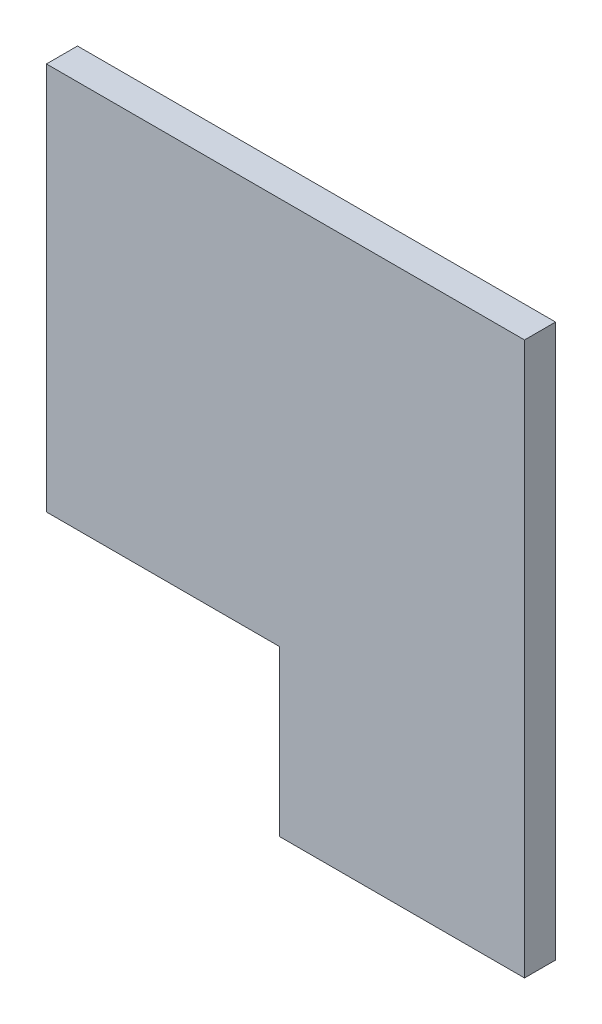
from build123d import *

# Parameters (mm, degrees)
TABAN_FLAN_1_DEPTH         = 50
KES_EKSTR_ZYON1_DEPTH      = 4481.915196698
KES_EKSTR_ZYON1_DEPTH_BACK = 4481.915196698
IZIM2_W                    = 942
IZIM2_H                    = 710
IZIM3_W                    = 11
IZIM3_H                    = 3300
SEKME1_DEPTH               = 50
KES_EKSTR_ZYON2_DEPTH      = 4486.833255929
KES_EKSTR_ZYON2_DEPTH_BACK = 4486.833255929
IZIM4_W                    = 1520
IZIM4_H                    = 310
KES_EKSTR_ZYON3_DEPTH      = 4486.833255929
KES_EKSTR_ZYON3_DEPTH_BACK = 4486.833255929
IZIM6_W                    = 7
IZIM6_H                    = 2435
KES_EKSTR_ZYON4_DEPTH      = 4337.484751501
KES_EKSTR_ZYON4_DEPTH_BACK = 4337.484751501
IZIM7_W                    = 360
IZIM7_H                    = 1550
KES_EKSTR_ZYON5_DEPTH      = 4213.683230436
KES_EKSTR_ZYON5_DEPTH_BACK = 4213.683230436
IZIM8_W                    = 3
IZIM8_H                    = 1550
IZIM8_W_2                  = 58
IZIM8_H_2                  = 885
IZIM9_W                    = 905
IZIM9_H                    = 5
SEKME2_DEPTH               = 50
KES_EKSTR_ZYON6_DEPTH      = 4212.765544282
KES_EKSTR_ZYON6_DEPTH_BACK = 4212.765544282
IZIM10_W                   = 101
IZIM10_H                   = 1555
KES_EKSTR_ZYON7_DEPTH      = 4183.008608313
KES_EKSTR_ZYON7_DEPTH_BACK = 4183.008608313
IZIM11_W                   = 409
IZIM11_H                   = 1555
KES_EKSTR_ZYON8_DEPTH      = 4085.890329005
KES_EKSTR_ZYON8_DEPTH_BACK = 4085.890329005
IZIM13_W                   = 395
IZIM13_H                   = 665


# Sheet-metal steps are written as plain solids
with BuildPart() as part:
    # Çizim1 → Taban-Flanş1 (new body)
    with BuildSketch(Plane.XY):
        Polygon((0, 0), (1427, 0), (1427, 710), (1999, 710), (1999, 4010), (0, 4010), align=None)
    extrude(amount=-TABAN_FLAN_1_DEPTH)

    # Çizim2 → Kes-Ekstrüzyon1 (cut, two sides: drawn at the far end of the back side and taken through both)
    with BuildSketch(Plane.XY.offset(-KES_EKSTR_ZYON1_DEPTH_BACK)):
        with Locations((956, 355)):
            Rectangle(IZIM2_W, IZIM2_H)
    extrude(amount=KES_EKSTR_ZYON1_DEPTH + KES_EKSTR_ZYON1_DEPTH_BACK, mode=Mode.SUBTRACT)

    # Çizim3 → Sekme1 (add)
    with BuildSketch(Plane.XY):
        with Locations((2004.5, 2360)):
            Rectangle(IZIM3_W, IZIM3_H)
    extrude(amount=-SEKME1_DEPTH)

    # Çizim4 → Kes-Ekstrüzyon2 (cut, two sides: drawn at the far end of the back side and taken through both)
    with BuildSketch(Plane.XY.offset(-KES_EKSTR_ZYON2_DEPTH_BACK)):
        with Locations((1250, 865)):
            Rectangle(IZIM4_W, IZIM4_H)
    extrude(amount=KES_EKSTR_ZYON2_DEPTH + KES_EKSTR_ZYON2_DEPTH_BACK, mode=Mode.SUBTRACT)

    # Çizim6 → Kes-Ekstrüzyon3 (cut, two sides: drawn at the far end of the back side and taken through both)
    with BuildSketch(Plane.XY.offset(-KES_EKSTR_ZYON3_DEPTH_BACK)):
        Polygon((440, 2460), (440, 1575), (440, 1020), (490, 1020), (2010, 1020), (2010, 4010), (1650, 4010), (1650, 2460), align=None)
        Polygon((7, 1575), (0, 1575), (0, 0), (485, 0), (485, 710), (490, 710), (490, 1020), (440, 1020), (440, 1575), align=None)
        with Locations((3.5, 2792.5)):
            Rectangle(IZIM6_W, IZIM6_H)
    extrude(amount=KES_EKSTR_ZYON3_DEPTH + KES_EKSTR_ZYON3_DEPTH_BACK, mode=Mode.SUBTRACT)

    # Çizim7 → Kes-Ekstrüzyon4 (cut, two sides: drawn at the far end of the back side and taken through both)
    with BuildSketch(Plane.XY.offset(-KES_EKSTR_ZYON4_DEPTH_BACK)):
        with Locations((1470, 3235)):
            Rectangle(IZIM7_W, IZIM7_H)
    extrude(amount=KES_EKSTR_ZYON4_DEPTH + KES_EKSTR_ZYON4_DEPTH_BACK, mode=Mode.SUBTRACT)

    # Çizim8 → Kes-Ekstrüzyon5 (cut, two sides: drawn at the far end of the back side and taken through both)
    with BuildSketch(Plane.XY.offset(-KES_EKSTR_ZYON5_DEPTH_BACK)):
        Polygon((382, 3385), (7, 3385), (7, 1575), (382, 1575), (382, 2460), align=None)
        with Locations((1288.5, 3235)):
            Rectangle(IZIM8_W, IZIM8_H)
        with Locations((411, 2017.5)):
            Rectangle(IZIM8_W_2, IZIM8_H_2)
    extrude(amount=KES_EKSTR_ZYON5_DEPTH + KES_EKSTR_ZYON5_DEPTH_BACK, mode=Mode.SUBTRACT)

    # Çizim9 → Sekme2 (add)
    with BuildSketch(Plane.XY):
        with Locations((834.5, 2457.5)):
            Rectangle(IZIM9_W, IZIM9_H)
    extrude(amount=-SEKME2_DEPTH)

    # Çizim10 → Kes-Ekstrüzyon6 (cut, two sides: drawn at the far end of the back side and taken through both)
    with BuildSketch(Plane.XY.offset(-KES_EKSTR_ZYON6_DEPTH_BACK)):
        with Locations((1236.5, 3232.5)):
            Rectangle(IZIM10_W, IZIM10_H)
    extrude(amount=KES_EKSTR_ZYON6_DEPTH + KES_EKSTR_ZYON6_DEPTH_BACK, mode=Mode.SUBTRACT)

    # Çizim11 → Kes-Ekstrüzyon7 (cut, two sides: drawn at the far end of the back side and taken through both)
    with BuildSketch(Plane.XY.offset(-KES_EKSTR_ZYON7_DEPTH_BACK)):
        with Locations((981.5, 3232.5)):
            Rectangle(IZIM11_W, IZIM11_H)
    extrude(amount=KES_EKSTR_ZYON7_DEPTH + KES_EKSTR_ZYON7_DEPTH_BACK, mode=Mode.SUBTRACT)

    # Çizim13 → Kes-Ekstrüzyon8 (cut, two sides: drawn at the far end of the back side and taken through both)
    with BuildSketch(Plane.XY.offset(-KES_EKSTR_ZYON8_DEPTH_BACK)):
        with Locations((579.5, 2787.5)):
            Rectangle(IZIM13_W, IZIM13_H)
    extrude(amount=KES_EKSTR_ZYON8_DEPTH + KES_EKSTR_ZYON8_DEPTH_BACK, mode=Mode.SUBTRACT)


solid = part.part
